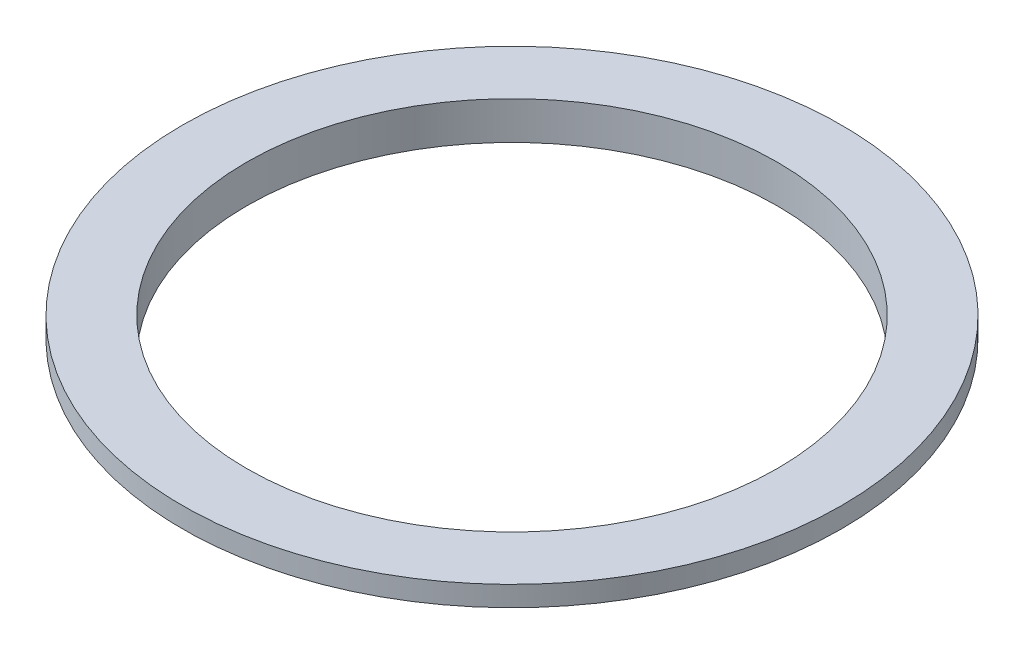
from build123d import *


with BuildPart() as part:
    # Sketch3 → Cap (revolve)
    with BuildSketch(Plane.XY):
        Polygon((-55, 8.3), (-52.5, 8.3), (-52.5, 15.8), (-65.2, 15.8), (-65.2, 11.8), (-55, 11.8), align=None)
    revolve(axis=Axis((0, 0, 0), (0, 1, 0)))


solid = part.part
